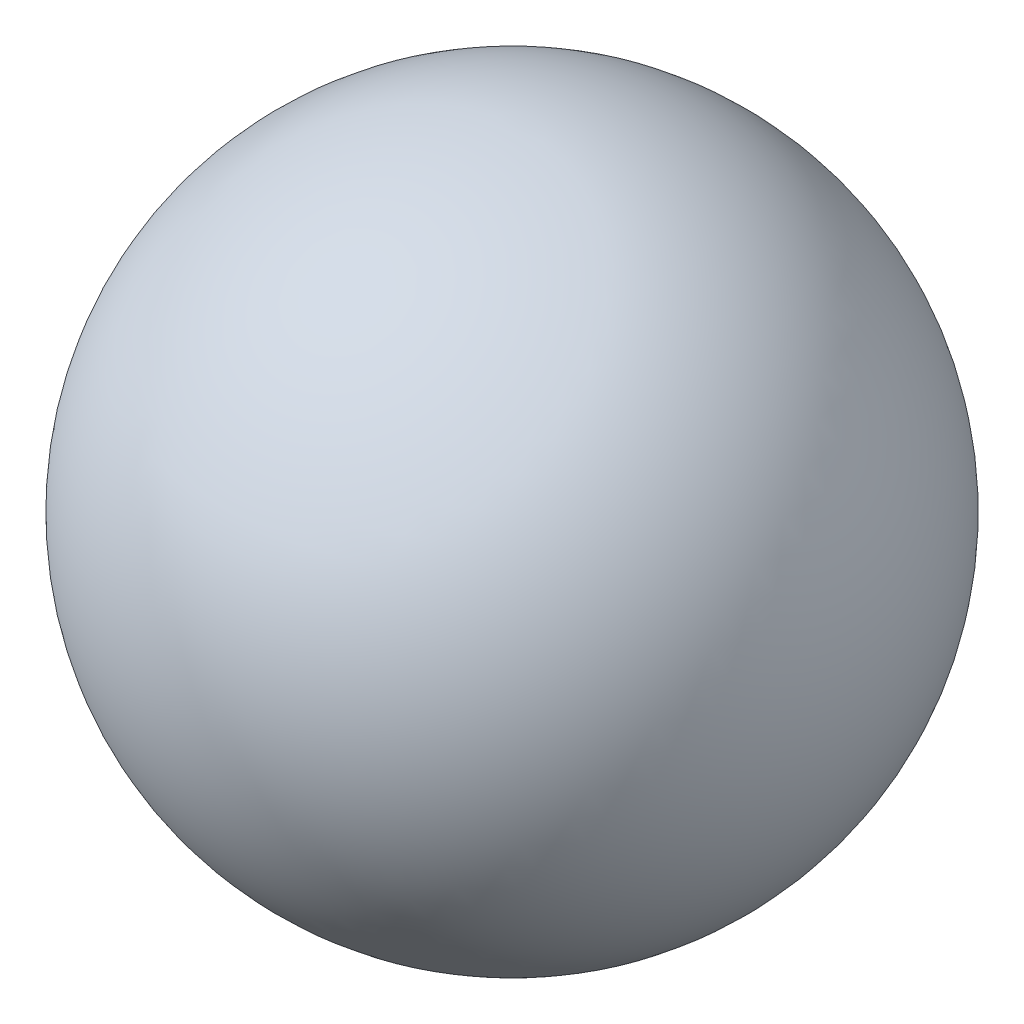
from build123d import *


with BuildPart() as part:
    # 草图1 → 旋转3 (revolve)
    with BuildSketch(Plane.XY):
        with BuildLine():
            Line((0, 30), (0, -30))
            ThreePointArc((0, -30), (30, 0), (0, 30))
        make_face()
    revolve(axis=Axis((0, 17.310975334, 0), (0, -1, 0)))


solid = part.part
